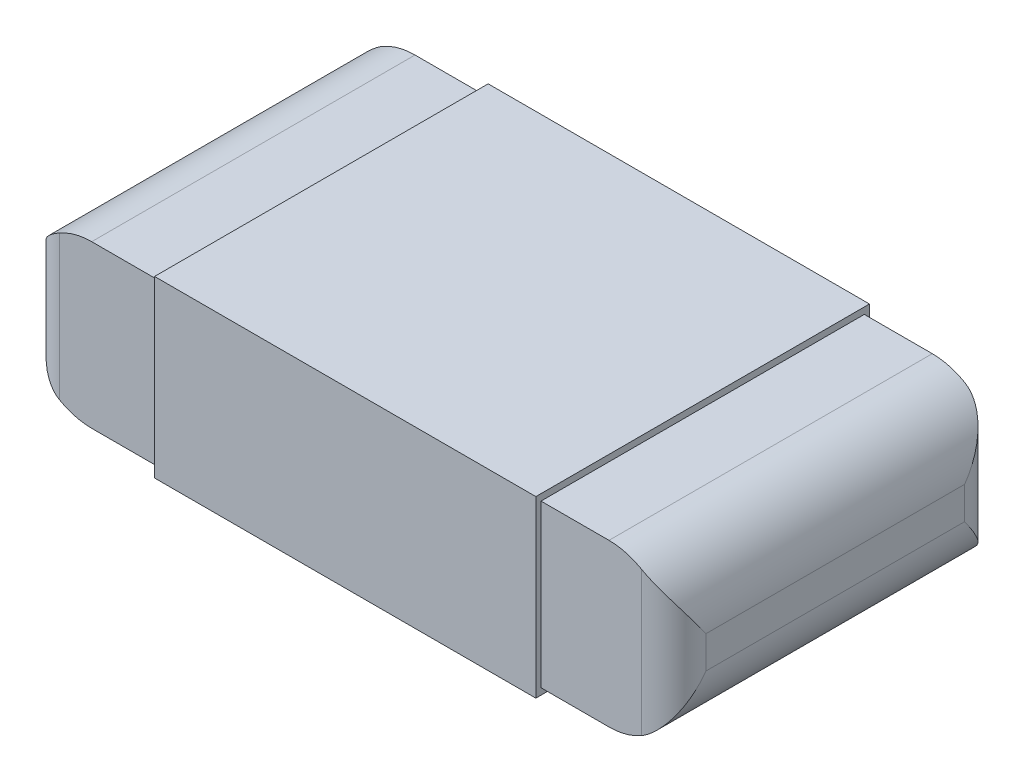
from build123d import *

# Parameters (mm, degrees)
BOSS_EXTRU_1_DEPTH      = 0.5
BOSS_EXTRU_2_DEPTH      = 0.02
BOSS_EXTRU_2_DEPTH_BACK = 0.52
ESQUISSE2_W             = 1.179373422
ESQUISSE2_H             = 1.03185074
CONG_2_R                = 0.2
CONG_3_R                = 0.2
CONG_4_R                = 0.2
CONG_5_R                = 0.2


with BuildPart() as part:
    # Esquisse1 → Boss.-Extru.1 (new body)
    with BuildSketch(Plane(origin=(0, 0, 0), x_dir=(1, 0, 0), z_dir=(0, 1, 0))):
        with BuildLine():
            Line((0.9, -0.5), (-0.9, -0.5))
            ThreePointArc((-0.9, -0.5), (-0.970710678, -0.470710678), (-1, -0.4))
            Line((-1, -0.4), (-1, 0.4))
            ThreePointArc((-1, 0.4), (-0.970710678, 0.470710678), (-0.9, 0.5))
            Line((-0.9, 0.5), (0.9, 0.5))
            ThreePointArc((0.9, 0.5), (0.970710678, 0.470710678), (1, 0.4))
            Line((1, 0.4), (1, -0.4))
            ThreePointArc((1, -0.4), (0.970710678, -0.470710678), (0.9, -0.5))
        make_face()
    extrude(amount=BOSS_EXTRU_1_DEPTH)

    # Esquisse2 → Boss.-Extru.2 (add, two sides: drawn at the far end of the back side and taken through both)
    with BuildSketch(Plane(origin=(0, 0.5, 0), x_dir=(1, 0, 0), z_dir=(0, 1, 0)).offset(-BOSS_EXTRU_2_DEPTH_BACK)):
        Rectangle(ESQUISSE2_W, ESQUISSE2_H)
    extrude(amount=BOSS_EXTRU_2_DEPTH + BOSS_EXTRU_2_DEPTH_BACK)

    # Congé2
    # the kernel refuses this fillet: 0.2 mm, written as the material it takes off along each edge
    with BuildSketch(Plane(origin=(-1, 0, 0.9), x_dir=(1, 0, 0), z_dir=(0, 0, -1))) as cong_2_piece_1:
        with BuildLine():
            CenterArc((CONG_2_R, -CONG_2_R), CONG_2_R, 90, 90)
            Line((0, -CONG_2_R), (0, 0))
            Line((0, 0), (CONG_2_R, 0))
        make_face()
    extrude(amount=1.8, mode=Mode.SUBTRACT)

    # Congé3
    # the kernel refuses this fillet: 0.2 mm, written as the material it takes off along each edge
    with BuildSketch(Plane(origin=(-1, 0.5, 0.9), x_dir=(1, 0, 0), z_dir=(0, 0, -1))) as cong_3_piece_1:
        with BuildLine():
            CenterArc((CONG_3_R, CONG_3_R), CONG_3_R, 180, 90)
            Line((0, CONG_3_R), (0, 0))
            Line((0, 0), (CONG_3_R, 0))
        make_face()
    extrude(amount=1.8, mode=Mode.SUBTRACT)

    # Congé4
    # the kernel refuses this fillet: 0.2 mm, written as the material it takes off along each edge
    with BuildSketch(Plane(origin=(1, 0.5, -0.9), x_dir=(-1, 0, 0), z_dir=(0, 0, 1))) as cong_4_piece_1:
        with BuildLine():
            CenterArc((CONG_4_R, CONG_4_R), CONG_4_R, 180, 90)
            Line((0, CONG_4_R), (0, 0))
            Line((0, 0), (CONG_4_R, 0))
        make_face()
    extrude(amount=1.8, mode=Mode.SUBTRACT)

    # Congé5
    # the kernel refuses this fillet: 0.2 mm, written as the material it takes off along each edge
    with BuildSketch(Plane(origin=(1, 0, -0.9), x_dir=(-1, 0, 0), z_dir=(0, 0, 1))) as cong_5_piece_1:
        with BuildLine():
            CenterArc((CONG_5_R, -CONG_5_R), CONG_5_R, 90, 90)
            Line((0, -CONG_5_R), (0, 0))
            Line((0, 0), (CONG_5_R, 0))
        make_face()
    extrude(amount=1.8, mode=Mode.SUBTRACT)


solid = part.part
